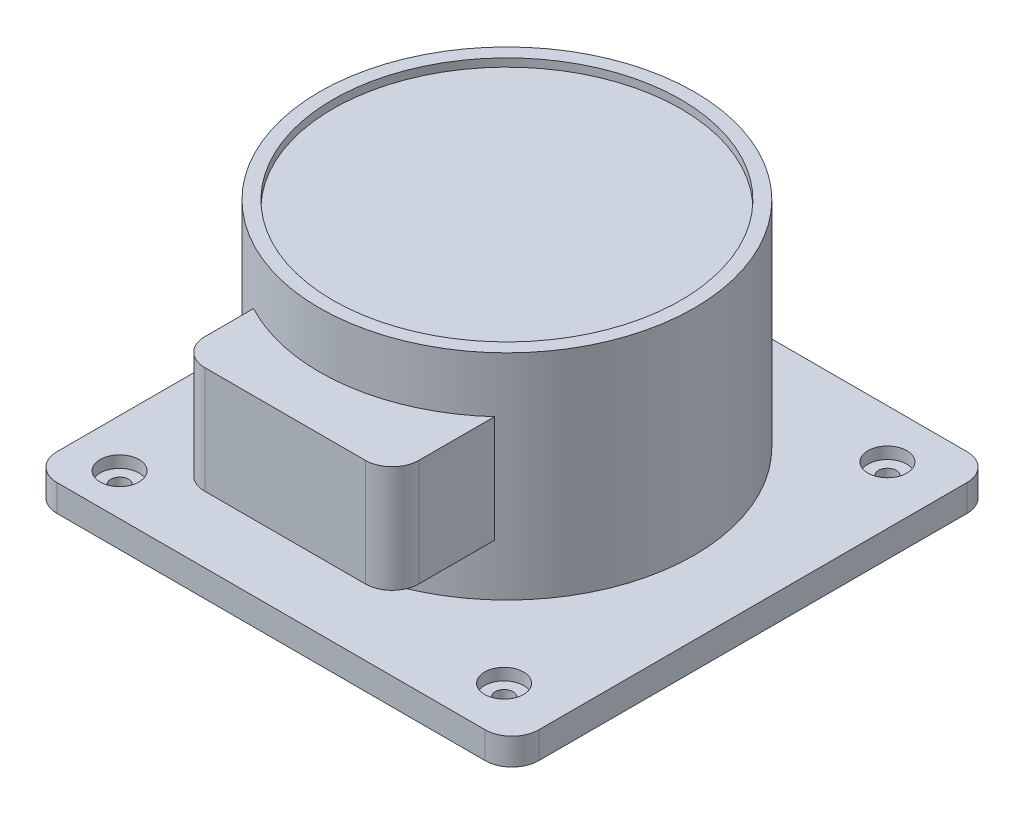
from build123d import *

# Parameters (mm, degrees)
SKETCH1_W                               = 180
SKETCH1_H                               = 180
BOSS_EXTRUDE1_DEPTH                     = 10
SKETCH2_R                               = 70
BOSS_EXTRUDE2_DEPTH                     = 80
SKETCH3_W                               = 80
SKETCH3_H                               = 40
BOSS_EXTRUDE3_DEPTH                     = 90
SKETCH4_R                               = 65
CUT_EXTRUDE1_DEPTH                      = 3
CBORE_FOR_M6_HEX_HEAD_BOLT1_D           = 6.6
CBORE_FOR_M6_HEX_HEAD_BOLT1_CBORE_D     = 14.55
CBORE_FOR_M6_HEX_HEAD_BOLT1_CBORE_DEPTH = 4.38
FILLET1_R                               = 10


with BuildPart() as part:
    # Sketch1 → Boss-Extrude1 (new body)
    with BuildSketch(Plane(origin=(0, 0, 0), x_dir=(1, 0, 0), z_dir=(0, 1, 0))):
        with Locations((-49.591836735, -5.510204082)):
            Rectangle(SKETCH1_W, SKETCH1_H)
    extrude(amount=BOSS_EXTRUDE1_DEPTH)

    # Sketch2 → Boss-Extrude2 (add)
    with BuildSketch(Plane(origin=(0, 10, 0), x_dir=(1, 0, 0), z_dir=(0, 1, 0))):
        with Locations((-57.006666854, 0)):
            Circle(SKETCH2_R)
    extrude(amount=BOSS_EXTRUDE2_DEPTH)

    # Sketch3 → Boss-Extrude3 (add)
    with BuildSketch(Plane.XY):
        with Locations((-49.893940427, 49.288531055)):
            Rectangle(SKETCH3_W, SKETCH3_H)
    extrude(amount=BOSS_EXTRUDE3_DEPTH)

    # Sketch4 → Cut-Extrude1 (cut)
    with BuildSketch(Plane(origin=(0, 90, 0), x_dir=(1, 0, 0), z_dir=(0, 1, 0))):
        with Locations((-57.006666854, 0)):
            Circle(SKETCH4_R)
    extrude(amount=-CUT_EXTRUDE1_DEPTH, mode=Mode.SUBTRACT)

    # CBORE for M6 Hex Head Bolt1 (through all)
    with Locations(Plane(origin=(0, 10, 0), x_dir=(1, 0, 0), z_dir=(0, 1, 0))):
        with Locations((-121.727687168, 66.314718067), (18.854420034, 66.314718067), (18.854420034, -76.9115667), (-121.727687168, -79.996440525)):
            CounterBoreHole(CBORE_FOR_M6_HEX_HEAD_BOLT1_D / 2, CBORE_FOR_M6_HEX_HEAD_BOLT1_CBORE_D / 2, CBORE_FOR_M6_HEX_HEAD_BOLT1_CBORE_DEPTH)

    # Fillet1
    fillet1_edges = [part.edges().sort_by_distance(p)[0] for p in [
        (-9.893940427, 49.288531055, 90),
        (-89.893940427, 49.288531055, 90),
        (-139.591836735, 5, -84.489795918),
        (40.408163265, 5, -84.489795918),
        (40.408163265, 5, 95.510204082),
        (-139.591836735, 5, 95.510204082),
    ]]
    fillet(fillet1_edges, radius=FILLET1_R)


solid = part.part
